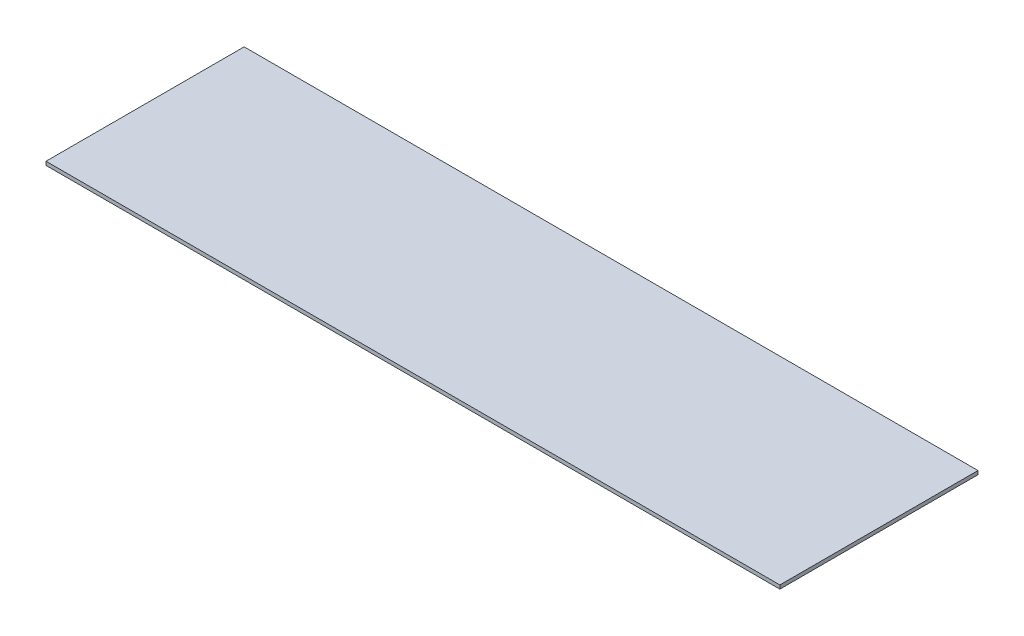
from build123d import *

# Parameters (mm, degrees)
SKETCH1_W           = 635
SKETCH1_H           = 171.45
BOSS_EXTRUDE1_DEPTH = 3.175


with BuildPart() as part:
    # Sketch1 → Boss-Extrude1 (new body)
    with BuildSketch(Plane(origin=(0, 0, 0), x_dir=(1, 0, 0), z_dir=(0, 1, 0))):
        with Locations((159.437783375, -28.50302267)):
            Rectangle(SKETCH1_W, SKETCH1_H)
    extrude(amount=BOSS_EXTRUDE1_DEPTH)


solid = part.part
